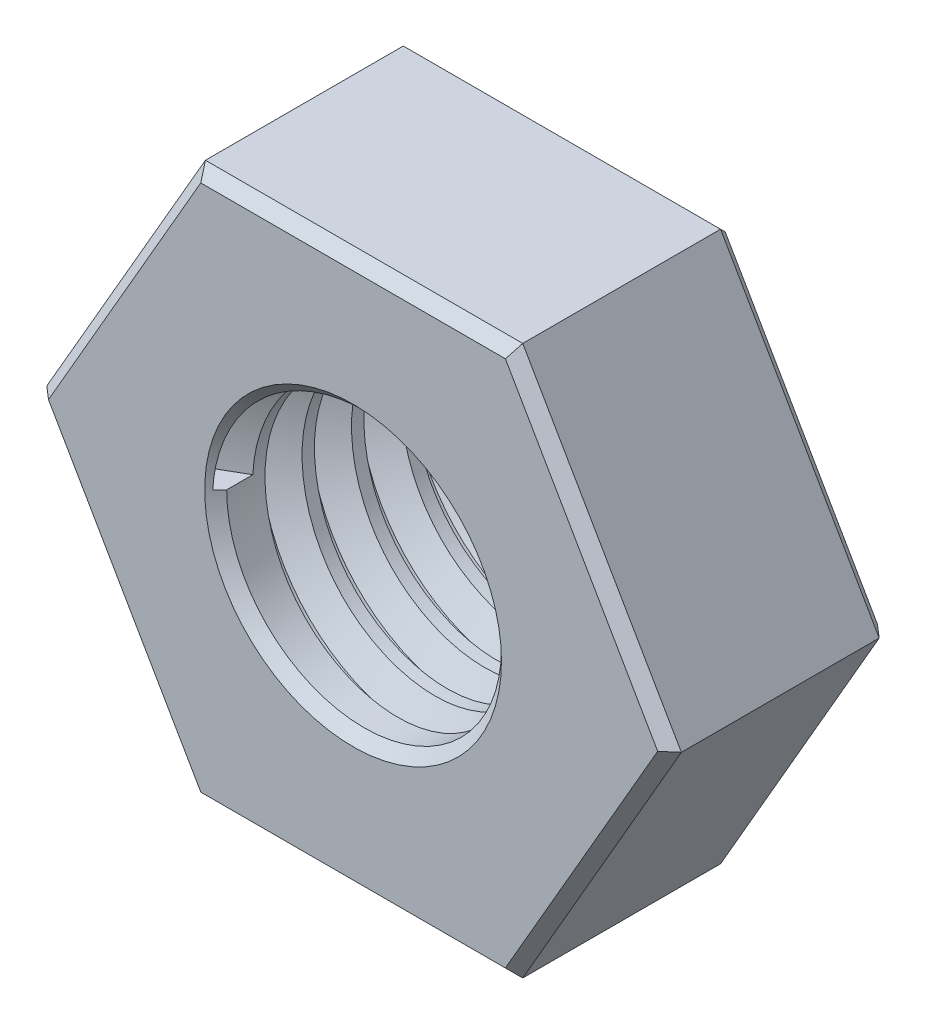
from build123d import *

# Parameters (mm, degrees)
SKETCH1_R           = 1.25
BOSS_EXTRUDE1_DEPTH = 2
THREAD1_PITCH       = 0.45
CHAMFER1_SIZE       = 0.1
CHAMFER2_SIZE       = 0.1


with BuildPart() as part:
    # Sketch1 → Boss-Extrude1 (new body)
    with BuildSketch(Plane.XY):
        Polygon((2.886751346, 0), (1.443375673, 2.5), (-1.443375673, 2.5), (-2.886751346, 0), (-1.443375673, -2.5), (1.443375673, -2.5), align=None)
        Circle(SKETCH1_R, mode=Mode.SUBTRACT)
    extrude(amount=BOSS_EXTRUDE1_DEPTH)

    # Thread1: the profile of Thread Profile1 profile screwed along a right-hand helix of 4.444444 turns, 6 arcs to a turn; built about Z, then put on its axis
    thread1_z = Axis((0, 0, 0), (0, 0, 1))
    thread1_corners = [(1.2497, 0, -0.000173205), (1.493569644, 0, 0.140624999), (1.493569644, 0, 0.196874999), (1.2497, 0, 0.337673204)]
    with BuildLine(mode=Mode.PRIVATE) as thread1_profile:
        Line(thread1_corners[0], thread1_corners[1])
        Line(thread1_corners[1], thread1_corners[2])
        Line(thread1_corners[2], thread1_corners[3])
        Line(thread1_corners[3], thread1_corners[0])
    thread1_cap = Face(thread1_profile.wire())
    thread1_turn_angles = [0, 30, 60, 90, 120, 150, 180, 210, 240, 270, 300, 330, 360]
    thread1_turn_weights = [1, 0.8660254037844387, 1, 0.8660254037844387, 1, 0.8660254037844387, 1, 0.8660254037844387, 1, 0.8660254037844387, 1, 0.8660254037844387, 1]
    thread1_turn_rails = [Edge.make_bspline([Vector(p[0], p[1], 0).rotate(thread1_z, thread1_turn_angles[k]) / thread1_turn_weights[k] + Vector(0, 0, p[2] + THREAD1_PITCH * thread1_turn_angles[k] / 360) for k in range(13)], [0, 0, 0, 1, 1, 2, 2, 3, 3, 4, 4, 5, 5, 6, 6, 6], 2, thread1_turn_weights) for p in thread1_corners]
    thread1_turn_sides = [Face.make_surface_from_curves(thread1_turn_rails[p[0]], thread1_turn_rails[p[1]]) for p in [(0, 1), (1, 2), (2, 3), (3, 0)]]
    thread1_last_angles = [1440, 1470, 1500, 1530, 1560, 1580, 1600]
    thread1_last_weights = [1, 0.8660254037844387, 1, 0.8660254037844387, 1, 0.9396926207859078, 1]
    thread1_last_rails = [Edge.make_bspline([Vector(p[0], p[1], 0).rotate(thread1_z, thread1_last_angles[k]) / thread1_last_weights[k] + Vector(0, 0, p[2] + THREAD1_PITCH * thread1_last_angles[k] / 360) for k in range(7)], [0, 0, 0, 1, 1, 2, 2, 3, 3, 3], 2, thread1_last_weights) for p in thread1_corners]
    thread1_last_sides = [Face.make_surface_from_curves(thread1_last_rails[p[0]], thread1_last_rails[p[1]]) for p in [(0, 1), (1, 2), (2, 3), (3, 0)]]
    thread1 = Plane(origin=(0, 0, 2), x_dir=(-1, 0, 0), z_dir=(0, 0, -1)) * Solid(Shell([*[p.moved(Location((0, 0, THREAD1_PITCH * i))) for i in range(4) for p in thread1_turn_sides], *thread1_last_sides, thread1_cap, thread1_cap.rotate(thread1_z, 1600).moved(Location((0, 0, THREAD1_PITCH * 1600 / 360)))]))
    add(thread1, mode=Mode.SUBTRACT)

    # Chamfer1
    # the kernel refuses this chamfer: 0.1 mm, written as the material it takes off along each edge
    with BuildSketch(Plane(origin=(0, 0, 2), x_dir=(1, 0, 0), z_dir=(0, -1, 0))) as chamfer1_piece_1:
        Polygon((1.25 + CHAMFER1_SIZE, 0), (1.25, -CHAMFER1_SIZE), (1.25, 0), align=None)
    revolve(axis=Axis((0, 0, 2), (0, 0, 1)), revolution_arc=180, mode=Mode.SUBTRACT)
    with BuildSketch(Plane(origin=(-1.700543972, -2.5, 2), x_dir=(0, 0.9996219169112966, 0.027495876610587302), z_dir=(1, 0, 0)), Plane(origin=(-3.015335495, 0.22271428, 2), x_dir=(0.8656979742248804, 0.4998109584556482, 0.02749587661058737), z_dir=(0.49999999999999983, -0.8660254037844388, 0)), Plane(origin=(-1.314791524, 2.72271428, 2), x_dir=(0.8656979742248804, -0.4998109584556482, 0.02749587661058738), z_dir=(-0.49999999999999994, -0.8660254037844388, 0))) as chamfer1_piece_2:
        Polygon((CHAMFER1_SIZE * 0.999621916911, -CHAMFER1_SIZE * 0.0274958766106), (-CHAMFER1_SIZE * 0.0274958766106, -CHAMFER1_SIZE * 0.999621916911), (0, 0), align=None)
    extrude(amount=3.401087944, mode=Mode.SUBTRACT)
    with BuildSketch(Plane(origin=(1.700543972, 2.5, 2), x_dir=(0, 0.027495876610587302, -0.9996219169112966), z_dir=(-1, 0, 0)), Plane(origin=(3.015335495, -0.22271428, 2), x_dir=(0.023812127644088885, 0.01374793830529245, -0.9996219169112968), z_dir=(-0.5000000000000001, 0.8660254037844386, 0)), Plane(origin=(1.314791524, -2.72271428, 2), x_dir=(0.023812127644090058, -0.013747938305293111, -0.9996219169112966), z_dir=(0.4999999999999996, 0.8660254037844389, 0))) as chamfer1_piece_3:
        Polygon((CHAMFER1_SIZE * 0.999621916911, CHAMFER1_SIZE * 0.0274958766106), (-CHAMFER1_SIZE * 0.0274958766106, CHAMFER1_SIZE * 0.999621916911), (0, 0), align=None)
    extrude(amount=3.401087944, mode=Mode.SUBTRACT)
    with BuildSketch(Plane(origin=(0, 0, 2), x_dir=(-1, 0, 0), z_dir=(0, 1, 0))) as chamfer1_piece_4:
        Polygon((1.25 + CHAMFER1_SIZE, 0), (1.25, -CHAMFER1_SIZE), (1.25, 0), align=None)
    revolve(axis=Axis((0, 0, 2), (0, 0, 1)), revolution_arc=180, mode=Mode.SUBTRACT)

    # Chamfer2
    chamfer2_edges = [part.edges().sort_by_distance(p)[0] for p in [
        (0, -2.5, 0),
        (-2.165063509, -1.25, 0),
        (-2.165063509, 1.25, 0),
        (0, 2.5, 0),
        (2.165063509, 1.25, 0),
        (2.165063509, -1.25, 0),
    ]]
    chamfer(chamfer2_edges, length=CHAMFER2_SIZE)


solid = part.part
